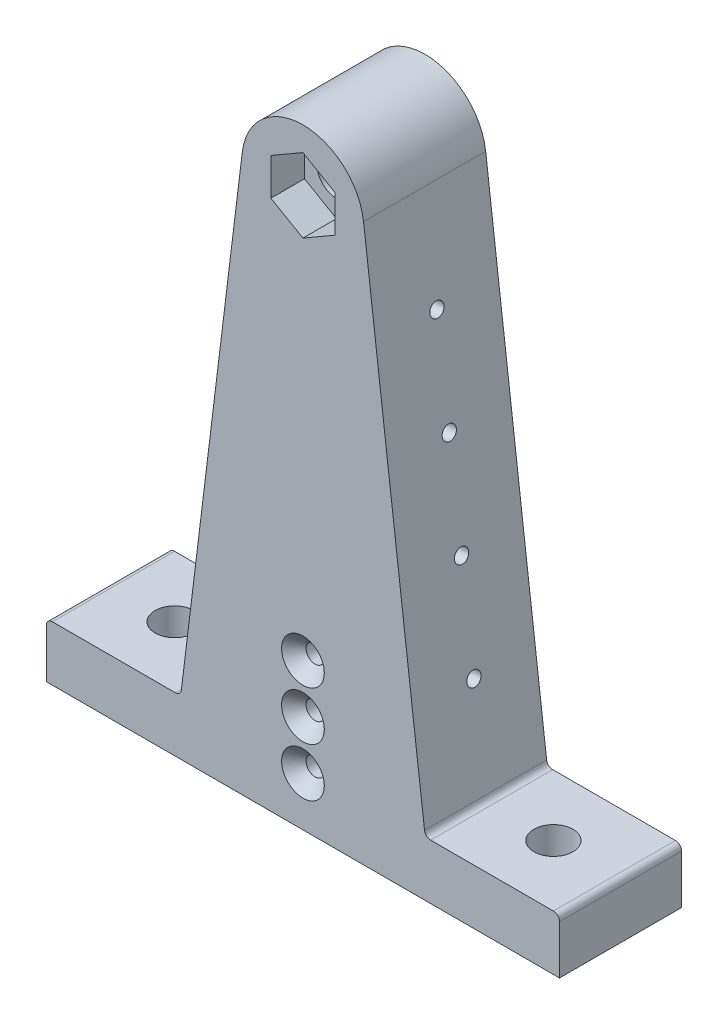
from build123d import *

# Parameters (mm, degrees)
SKETCH1_R           = 3.2
BOSS_EXTRUDE1_DEPTH = 20
SKETCH3_R           = 3.2
CUT_EXTRUDE1_DEPTH  = 103.209269795
CUT_EXTRUDE2_DEPTH  = 5.5
SKETCH6_R           = 1.5
CUT_EXTRUDE4_DEPTH  = 102.319962653
CHAMFER1_SIZE       = 2
SKETCH8_R           = 1.16
CUT_EXTRUDE5_DEPTH  = 10
FILLET1_R           = 1


with BuildPart() as part:
    # Sketch1 → Boss-Extrude1 (new body)
    with BuildSketch(Plane.XY):
        with BuildLine():
            Line((20.020647688, -81), (9.925461516, 1.218693434))
            ThreePointArc((9.925461516, 1.218693434), (0, 10), (-9.925461516, 1.218693434))
            Line((-9.925461516, 1.218693434), (-20.020647688, -81))
            Line((-20.020647688, -81), (-42.020647688, -81))
            Line((-42.020647688, -81), (-42.020647688, -90))
            Line((-42.020647688, -90), (42.020647688, -90))
            Line((42.020647688, -90), (42.020647688, -81))
            Line((42.020647688, -81), (20.020647688, -81))
        make_face()
        Circle(SKETCH1_R, mode=Mode.SUBTRACT)
    extrude(amount=BOSS_EXTRUDE1_DEPTH)

    # Sketch3 → Cut-Extrude1 (cut, through all)
    with BuildSketch(Plane(origin=(0, -81, 0), x_dir=(1, 0, 0), z_dir=(0, 1, 0))):
        with Locations((-31.020647688, -10)):
            Circle(SKETCH3_R)
        with Locations((31.020647688, -10)):
            Circle(SKETCH3_R)
    extrude(amount=-CUT_EXTRUDE1_DEPTH, mode=Mode.SUBTRACT)

    # Sketch4 → Cut-Extrude2 (cut)
    with BuildSketch(Plane.XY.offset(20)):
        Polygon((0, 6.062177826), (-5.25, 3.031088913), (-5.25, -3.031088913), (0, -6.062177826), (5.25, -3.031088913), (5.25, 3.031088913), align=None)
    extrude(amount=-CUT_EXTRUDE2_DEPTH, mode=Mode.SUBTRACT)

    # Sketch6 → Cut-Extrude4 (cut, through all)
    with BuildSketch(Plane.XY.offset(20)):
        with Locations((0, -66)):
            Circle(SKETCH6_R)
        with Locations((0, -74)):
            Circle(SKETCH6_R)
        with Locations((0, -82)):
            Circle(SKETCH6_R)
    extrude(amount=-CUT_EXTRUDE4_DEPTH, mode=Mode.SUBTRACT)

    # Chamfer1
    chamfer1_edges = [part.edges().sort_by_distance(p)[0] for p in [
        (-1.5, -82, 20),
        (-1.5, -74, 20),
        (-1.5, -66, 20),
    ]]
    chamfer(chamfer1_edges, length=CHAMFER1_SIZE)

    # Sketch8 → Cut-Extrude5 (cut)
    with BuildSketch(Plane(origin=(-9.925461516, 1.218693434, 0), x_dir=(0, 0, 1), z_dir=(-0.992546151641322, 0.12186934340514775, 0))):
        with Locations((10, -16.567228294)):
            Circle(SKETCH8_R)
        with Locations((10, -33.134456588)):
            Circle(SKETCH8_R)
        with Locations((10, -49.701684883)):
            Circle(SKETCH8_R)
        with Locations((10, -66.268913177)):
            Circle(SKETCH8_R)
    cut_extrude5 = extrude(amount=-CUT_EXTRUDE5_DEPTH, mode=Mode.SUBTRACT)

    # Mirror1: Cut-Extrude5 across plane
    add(cut_extrude5.mirror(Plane(origin=(0, 0, 0), x_dir=(0, 0, 1), z_dir=(1, 0, 0))), mode=Mode.SUBTRACT)

    # Fillet1
    fillet1_edges = [part.edges().sort_by_distance(p)[0] for p in [
        (-42.020647688, -81, 10),
        (-20.020647688, -81, 10),
        (42.020647688, -81, 10),
        (20.020647688, -81, 10),
    ]]
    fillet(fillet1_edges, radius=FILLET1_R)


solid = part.part
